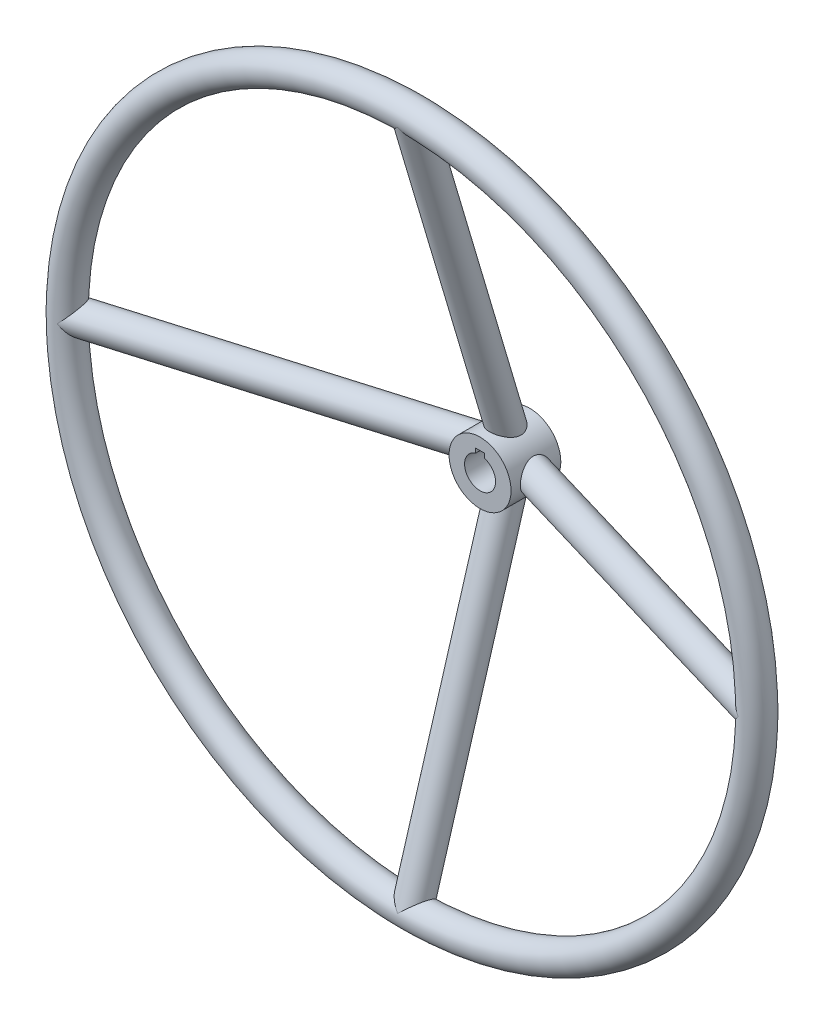
from build123d import *
from build123d.topology import SkipClean

# Parameters (mm, degrees)
SKETCH1_R               = 13.5
SKETCH1_R_2             = 10.5
BOSS_EXTRUDE1_START     = -106.5
SKETCH3_R               = 28
SKETCH3_R_2             = 14
BOSS_EXTRUDE1_DEPTH     = 45
SWEEP1_PROFILE_R        = 13.5
SKETCH11_R              = 12
CUT_EXTRUDE1_DEPTH      = 295.682684647
BOSS_EXTRUDE2_REACH     = 475.963
CIRPATTERN1_START       = -298.665612109
CIRPATTERN1_OUTLINE_R   = 12
CIRPATTERN1_DEPTH       = 300.355319759
CIRPATTERN1_2_OUTLINE_R = 12
CIRPATTERN1_2_DEPTH     = 300.355319759
CIRPATTERN1_START_2     = -1.68970765
CIRPATTERN1_3_OUTLINE_R = 12
CIRPATTERN1_3_DEPTH     = 300.355319759
CIRPATTERN1_4_OUTLINE_R = 12
CIRPATTERN1_4_DEPTH     = 295.682684647
CIRPATTERN1_5_OUTLINE_R = 12
CIRPATTERN1_5_DEPTH     = 295.682684647
CIRPATTERN1_START_3     = 2.982927462
CIRPATTERN1_6_OUTLINE_R = 12
CIRPATTERN1_6_DEPTH     = 295.682684647
CUT_EXTRUDE2_DEPTH      = 476.026315223
CUT_EXTRUDE2_DEPTH_BACK = 476.026315223
SKETCH16_W              = 7.9375
SKETCH16_H              = 3.96875


# Read off the part's stored shape, not the designer's step: CirPattern1
with BuildPart() as part:
    # Sketch1 → Revolve1 (revolve)
    with BuildSketch(Plane(origin=(0, 0, 0), x_dir=(0, 0, -1), z_dir=(1, 0, 0)), mode=Mode.PRIVATE) as revolve1_sk:
        with Locations((0, 311.5)):
            Circle(SKETCH1_R)
        with Locations((0, 311.5)):
            Circle(SKETCH1_R_2, mode=Mode.SUBTRACT)
    revolve(revolve1_sk.sketch.rotate(Axis((0, 0, 0), (0, 0, 1)), 90), axis=Axis((0, 0, 0), (0, 0, 1)))



with BuildPart() as body_2:
    # Sketch3 → Boss-Extrude1 (new body)
    with BuildSketch(Plane.XY.offset(BOSS_EXTRUDE1_START)):
        with Locations(Location((0, 0, 0), (0, 0, 180))):
            Circle(SKETCH3_R)
        with Locations(Location((0, 0, 0), (0, 0, 180))):
            Circle(SKETCH3_R_2, mode=Mode.SUBTRACT)
    extrude(amount=BOSS_EXTRUDE1_DEPTH)


with BuildPart() as part_1:
    add(part.part)

    add(body_2.part)  # Sweep1 merges body 2
    # Sweep1: sweep along a path in Sketch4
    with BuildLine(Plane(origin=(0, 0, 0), x_dir=(0, 0, -1), z_dir=(1, 0, 0))) as sweep1_path:
        Line((0, 311.5), (84, 28))
    # Sweep1 profile (on start of the path) → Sweep1 (sweep)
    with BuildSketch(Plane(origin=(0, 311.5, 0), x_dir=(0, 0.284088329691374, -0.9587981127083873), z_dir=(0, -0.9587981127083873, -0.284088329691374))):
        Circle(SWEEP1_PROFILE_R)
    sweep(path=sweep1_path.line)

    # Sketch11 → Cut-Extrude1 (cut)
    with BuildSketch(Plane(origin=(0, 2.860025221, 0.84741488), x_dir=(1, 0, 0), z_dir=(0, -0.9587981127083873, -0.28408832969137415))):
        with Locations(Location((0, -87.039829846, 0), (0, 0, 264.936945275))):
            Circle(SKETCH11_R)
    extrude(amount=-CUT_EXTRUDE1_DEPTH, mode=Mode.SUBTRACT)

    # Sketch12 → Boss-Extrude2 (add, up to next)
    with BuildSketch(Plane(origin=(0, 2.860025221, 0.84741488), x_dir=(1, 0, 0), z_dir=(0, -0.9587981127083873, -0.28408832969137415)), mode=Mode.PRIVATE) as boss_extrude2_sk1:
        with BuildLine():
            ThreePointArc((-10.521801241, -81.269933952), (0, -99.039829846), (10.521801241, -81.269933952))
            add(Edge.make_bspline(
                [(10.521801241, -81.269933952), (10.744780231, -80.951661527), (10.966172428, -80.619947383)],
                knots=[0.385236826, 0.385236826, 0.385236826, 0.402423095, 0.402423095, 0.402423095], degree=2, weights=[1, 0.999963079, 1]))
            ThreePointArc((10.966172428, -80.619947383), (0, -101.993514699), (-10.966172428, -80.619947383))
            add(Edge.make_bspline(
                [(-10.966172428, -80.619947383), (-10.744780231, -80.951661527), (-10.521801241, -81.269933952)],
                knots=[5.880762212, 5.880762212, 5.880762212, 5.897948482, 5.897948482, 5.897948482], degree=2, weights=[1, 0.999963079, 1]))
        make_face()
    boss_extrude2_tool1 = extrude(boss_extrude2_sk1.sketch, amount=BOSS_EXTRUDE2_REACH, mode=Mode.PRIVATE) - part_1.part
    add(boss_extrude2_tool1.solids().sort_by_distance((-11.030111, 25.911101, -76.949965))[0])

    # CirPattern1 outline → CirPattern1 (add)
    with SkipClean():  # the faces are left unmerged after this step: merging them gives an invalid solid
        with BuildSketch(Plane(origin=(0, 0, 0), x_dir=(0, 1, 0), z_dir=(0.9587981127083872, 0, -0.28408832969137404)).offset(CIRPATTERN1_START)):
            with BuildLine():
                ThreePointArc((8.444165231, -77.960420493), (3.6e-06, -74.993514699), (-8.444159613, -77.960415989))
                ThreePointArc((-8.444159613, -77.960415989), (-13.499898801, -88.441242647), (-8.525474202, -98.960906429))
                ThreePointArc((-8.525474202, -98.960906429), (-8.495e-06, -101.993514699), (8.525461029, -98.960917158))
                ThreePointArc((8.525461029, -98.960917158), (13.499898848, -88.441254742), (8.444165231, -77.960420493))
            make_face()
            with Locations((0, -87.039829846)):
                Circle(CIRPATTERN1_OUTLINE_R, mode=Mode.SUBTRACT)
        extrude(amount=CIRPATTERN1_DEPTH)

    # CirPattern1 2 outline → CirPattern1 2 (add)
    with SkipClean():  # the faces are left unmerged after this step: merging them gives an invalid solid
        with BuildSketch(Plane(origin=(0, 0, 0), x_dir=(1, 0, 0), z_dir=(0, 0.9587981127083872, -0.28408832969137404)).offset(CIRPATTERN1_START)):
            with BuildLine():
                ThreePointArc((8.525474202, 98.960906429), (8.495e-06, 101.993514699), (-8.525461029, 98.960917158))
                ThreePointArc((-8.525461029, 98.960917158), (-13.499898848, 88.441254742), (-8.444165231, 77.960420493))
                ThreePointArc((-8.444165231, 77.960420493), (-3.6e-06, 74.993514699), (8.444159613, 77.960415989))
                ThreePointArc((8.444159613, 77.960415989), (13.499898801, 88.441242647), (8.525474202, 98.960906429))
            make_face()
            with Locations((0, 87.039829846)):
                Circle(CIRPATTERN1_2_OUTLINE_R, mode=Mode.SUBTRACT)
        extrude(amount=CIRPATTERN1_2_DEPTH)

    # CirPattern1 3 outline → CirPattern1 3 (add)
    with SkipClean():  # the faces are left unmerged after this step: merging them gives an invalid solid
        with BuildSketch(Plane(origin=(0, 0, 0), x_dir=(0, 1, 0), z_dir=(0.9587981127083872, 0, 0.28408832969137404)).offset(CIRPATTERN1_START_2)):
            with BuildLine():
                ThreePointArc((-8.444165231, -77.960420493), (-13.499898848, -88.441254742), (-8.525461029, -98.960917158))
                ThreePointArc((-8.525461029, -98.960917158), (8.495e-06, -101.993514699), (8.525474202, -98.960906429))
                ThreePointArc((8.525474202, -98.960906429), (13.499898801, -88.441242647), (8.444159613, -77.960415989))
                ThreePointArc((8.444159613, -77.960415989), (-3.6e-06, -74.993514699), (-8.444165231, -77.960420493))
            make_face()
            with Locations((0, -87.039829846)):
                Circle(CIRPATTERN1_3_OUTLINE_R, mode=Mode.SUBTRACT)
        extrude(amount=CIRPATTERN1_3_DEPTH)

    # CirPattern1 4 outline → CirPattern1 4 (cut)
    with SkipClean():  # the faces are left unmerged after this step: merging them gives an invalid solid
        with BuildSketch(Plane(origin=(0, 0, 0), x_dir=(0, 1, 0), z_dir=(0.9587981127083872, 0, -0.28408832969137404)).offset(CIRPATTERN1_START)):
            with Locations((0, -87.039829846)):
                Circle(CIRPATTERN1_4_OUTLINE_R)
        extrude(amount=CIRPATTERN1_4_DEPTH, mode=Mode.SUBTRACT)

    # CirPattern1 5 outline → CirPattern1 5 (cut)
    with SkipClean():  # the faces are left unmerged after this step: merging them gives an invalid solid
        with BuildSketch(Plane(origin=(0, 0, 0), x_dir=(1, 0, 0), z_dir=(0, 0.9587981127083872, -0.28408832969137404)).offset(CIRPATTERN1_START)):
            with Locations((0, 87.039829846)):
                Circle(CIRPATTERN1_5_OUTLINE_R)
        extrude(amount=CIRPATTERN1_5_DEPTH, mode=Mode.SUBTRACT)

    # CirPattern1 6 outline → CirPattern1 6 (cut)
    with SkipClean():  # the faces are left unmerged after this step: merging them gives an invalid solid
        with BuildSketch(Plane(origin=(0, 0, 0), x_dir=(0, 1, 0), z_dir=(0.9587981127083872, 0, 0.28408832969137404)).offset(CIRPATTERN1_START_3)):
            with Locations((0, -87.039829846)):
                Circle(CIRPATTERN1_6_OUTLINE_R)
        extrude(amount=CIRPATTERN1_6_DEPTH, mode=Mode.SUBTRACT)

    # Sketch16 → Cut-Extrude2 (cut, two sides: drawn at the far end of the back side and taken through both)
    with SkipClean():  # the faces are left unmerged after this step: merging them gives an invalid solid
        with BuildSketch(Plane(origin=(0, 0, -106.5), x_dir=(-1, 0, 0), z_dir=(0, 0, -1)).offset(-CUT_EXTRUDE2_DEPTH_BACK)):
            with Locations((0, 15.410060213)):
                Rectangle(SKETCH16_W, SKETCH16_H)
        extrude(amount=CUT_EXTRUDE2_DEPTH + CUT_EXTRUDE2_DEPTH_BACK, mode=Mode.SUBTRACT)


solid = part_1.part
